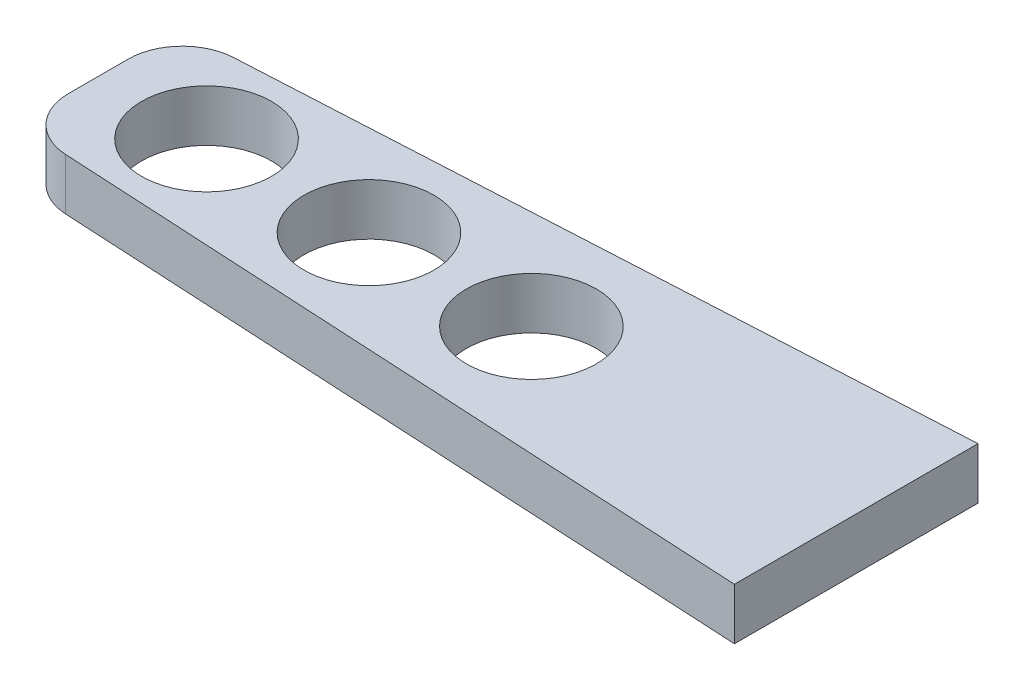
from build123d import *

# Parameters (mm, degrees)
SKETCH1_R           = 6
BOSS_EXTRUDE1_DEPTH = 4.7625
FILLET1_R           = 5


with BuildPart() as part:
    # Sketch1 → Boss-Extrude1 (new body)
    with BuildSketch(Plane(origin=(0, 0, 0), x_dir=(1, 0, 0), z_dir=(0, 1, 0))):
        Polygon((0, -11.25), (0, 11.25), (-70, 7.5), (-70, -7.5), align=None)
        with Locations((-60, 0)):
            Circle(SKETCH1_R, mode=Mode.SUBTRACT)
        with Locations((-45, 0)):
            Circle(SKETCH1_R, mode=Mode.SUBTRACT)
        with Locations((-30, 0)):
            Circle(SKETCH1_R, mode=Mode.SUBTRACT)
    extrude(amount=BOSS_EXTRUDE1_DEPTH)

    # Fillet1
    fillet1_edges = [part.edges().sort_by_distance(p)[0] for p in [
        (-70, 2.38125, 7.5),
        (-70, 2.38125, -7.5),
    ]]
    fillet(fillet1_edges, radius=FILLET1_R)


solid = part.part
